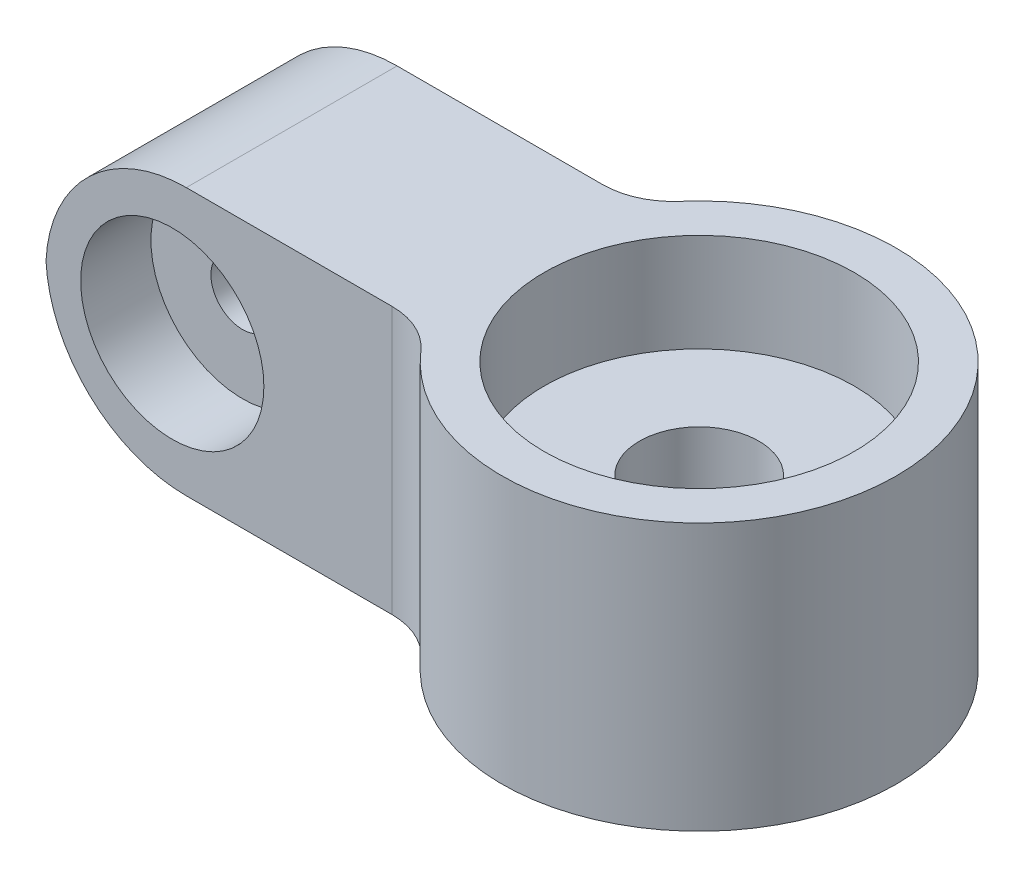
from build123d import *

# Parameters (mm, degrees)
BOSS_EXTRUDE1_DEPTH        = 7.5
CORTAR_EXTRUIR1_START      = 7.5
SKETCH1_3_R                = 6.52
CORTAR_EXTRUIR1_DEPTH      = 5
CORTAR_EXTRUIR2_START      = -7.5
SKETCH1_5_R                = 6.52
CORTAR_EXTRUIR2_DEPTH      = 5
BOSS_EXTRUDE3_DEPTH        = 9.5
BOSS_EXTRUDE3_DEPTH_BACK   = 9.5
SKETCH2_R                  = 14.04
SKETCH2_R_2                = 4.25
CORTAR_EXTRUIR3_START      = -9.5
SKETCH2_4_R                = 11.04
CORTAR_EXTRUIR3_DEPTH      = 7
CORTAR_EXTRUIR4_START      = 2.5
SKETCH2_5_R                = 11.04
CORTAR_EXTRUIR4_DEPTH      = 7
CORTAR_EXTRUIR5_DEPTH      = 56.683150055
CORTAR_EXTRUIR5_DEPTH_BACK = 56.683150055
SKETCH2_6_R                = 4.25
FILLET1_R                  = 5
FILLET2_R                  = 10


with BuildPart() as part:
    # Sketch1 → Boss-Extrude1 (new, symmetric)
    with BuildSketch(Plane.XY):
        with BuildLine():
            ThreePointArc((6.75, 0), (9, 2.25), (11.25, 0))
            Line((11.25, 0), (15.52, 0))
            ThreePointArc((15.52, 0), (9, 6.52), (2.48, 0))
            Line((2.48, 0), (6.75, 0))
        make_face()
        with BuildLine():
            Line((15.52, 0), (11.25, 0))
            ThreePointArc((11.25, 0), (9, -2.25), (6.75, 0))
            Line((6.75, 0), (2.48, 0))
            ThreePointArc((2.48, 0), (9, -6.52), (15.52, 0))
        make_face()
        with BuildLine():
            ThreePointArc((2.48, 0), (9, 6.52), (15.52, 0))
            Line((15.52, 0), (39, 0))
            Line((39, 0), (39, 9.5))
            Line((39, 9.5), (0, 9.5))
            Line((0, 9.5), (0, 0))
            Line((0, 0), (2.48, 0))
        make_face()
        with BuildLine():
            Line((39, 0), (15.52, 0))
            ThreePointArc((15.52, 0), (9, -6.52), (2.48, 0))
            Line((2.48, 0), (0, 0))
            Line((0, 0), (0, -9.5))
            Line((0, -9.5), (39, -9.5))
            Line((39, -9.5), (39, 0))
        make_face()
    extrude(amount=BOSS_EXTRUDE1_DEPTH, both=True)

    # Sketch1<3> → Cortar-Extruir1 (cut)
    with BuildSketch(Plane.XY.offset(CORTAR_EXTRUIR1_START)):
        with Locations((9, 0)):
            Circle(SKETCH1_3_R)
    extrude(amount=-CORTAR_EXTRUIR1_DEPTH, mode=Mode.SUBTRACT)

    # Sketch1<5> → Cortar-Extruir2 (cut)
    with BuildSketch(Plane.XY.offset(CORTAR_EXTRUIR2_START)):
        with Locations((9, 0)):
            Circle(SKETCH1_5_R)
    extrude(amount=CORTAR_EXTRUIR2_DEPTH, mode=Mode.SUBTRACT)

    # Sketch2 → Boss-Extrude3 (add, two sides: drawn at the far end of the back side and taken through both)
    with BuildSketch(Plane(origin=(0, 0, 0), x_dir=(1, 0, 0), z_dir=(0, 1, 0)).offset(-BOSS_EXTRUDE3_DEPTH_BACK)):
        with Locations((39, 0)):
            Circle(SKETCH2_R)
        with Locations((39, 0)):
            Circle(SKETCH2_R_2, mode=Mode.SUBTRACT)
    extrude(amount=BOSS_EXTRUDE3_DEPTH + BOSS_EXTRUDE3_DEPTH_BACK)

    # Sketch2<4> → Cortar-Extruir3 (cut)
    with BuildSketch(Plane(origin=(0, 0, 0), x_dir=(1, 0, 0), z_dir=(0, 1, 0)).offset(CORTAR_EXTRUIR3_START)):
        with Locations(Location((39, 0, 0), (0, 0, 270))):
            Circle(SKETCH2_4_R)
    extrude(amount=CORTAR_EXTRUIR3_DEPTH, mode=Mode.SUBTRACT)

    # Sketch2<5> → Cortar-Extruir4 (cut)
    with BuildSketch(Plane(origin=(0, 0, 0), x_dir=(1, 0, 0), z_dir=(0, 1, 0)).offset(CORTAR_EXTRUIR4_START)):
        with Locations(Location((39, 0, 0), (0, 0, 270))):
            Circle(SKETCH2_5_R)
    extrude(amount=CORTAR_EXTRUIR4_DEPTH, mode=Mode.SUBTRACT)

    # Sketch2<6> → Cortar-Extruir5 (cut, two sides: drawn at the far end of the back side and taken through both)
    with BuildSketch(Plane(origin=(0, 0, 0), x_dir=(1, 0, 0), z_dir=(0, 1, 0)).offset(-CORTAR_EXTRUIR5_DEPTH_BACK)):
        with Locations(Location((39, 0, 0), (0, 0, 270))):
            Circle(SKETCH2_6_R)
    extrude(amount=CORTAR_EXTRUIR5_DEPTH + CORTAR_EXTRUIR5_DEPTH_BACK, mode=Mode.SUBTRACT)

    # Fillet1
    fillet1_edges = [part.edges().sort_by_distance(p)[0] for p in [
        (27.13106576, 0, -7.5),
        (27.13106576, 0, 7.5),
    ]]
    fillet(fillet1_edges, radius=FILLET1_R)

    # Fillet2
    # the kernel refuses this fillet: 10 mm, written as the material it takes off along each edge
    with BuildSketch(Plane(origin=(0, -9.5, 32.5), x_dir=(1, 0, 0), z_dir=(0, 0, -1)), Plane(origin=(0, 9.5, 32.5), x_dir=(0, -1, 0), z_dir=(0, 0, -1))) as fillet2_piece_1:
        with BuildLine():
            CenterArc((FILLET2_R, -FILLET2_R), FILLET2_R, 90, 90)
            Line((0, -FILLET2_R), (0, 0))
            Line((0, 0), (FILLET2_R, 0))
        make_face()
    extrude(amount=65, mode=Mode.SUBTRACT)


solid = part.part
